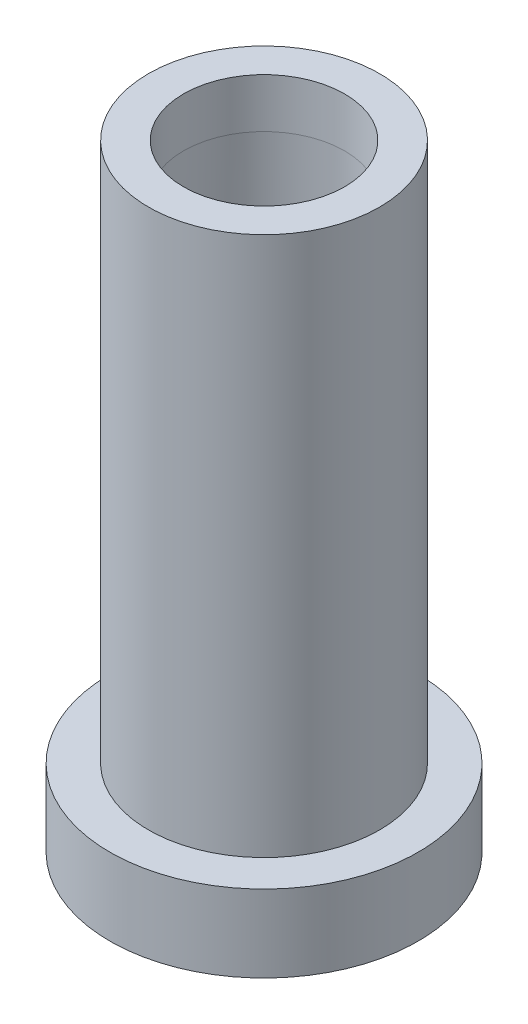
from build123d import *

# Parameters (mm, degrees)
CUT_EXTRUDE1_REACH = 44.426
SKETCH2_R          = 5.225


with BuildPart() as part:
    # Sketch1 → Revolve1 (revolve)
    with BuildSketch(Plane.XY):
        Polygon((0, 0), (10, 0), (10, 5), (7.5, 5), (7.5, 40), (0, 40), align=None)
    revolve(axis=Axis((0, 45, 0), (0, -1, 0)))

    # Sketch2 → Cut-Extrude1 (cut, up to next)
    with BuildSketch(Plane(origin=(0, 40, 0), x_dir=(1, 0, 0), z_dir=(0, 1, 0)), mode=Mode.PRIVATE) as cut_extrude1_sk1:
        Circle(SKETCH2_R)
    cut_extrude1_tool1 = extrude(cut_extrude1_sk1.sketch, amount=-CUT_EXTRUDE1_REACH, mode=Mode.PRIVATE) & part.part
    add(cut_extrude1_tool1.solids().sort_by_distance((0, 40, 0))[0], mode=Mode.SUBTRACT)

    # Cut-Sweep1: sweep along a curve in space
    with BuildLine() as cut_sweep1_path:
        ThreePointArc((0, 40, 5.225), (3.694632932, 40, 3.694632932), (5.225, 40, 0))
        ThreePointArc((5.225, 40, 0), (3.694632932, 40, -3.694632932), (0, 40, -5.225))
        ThreePointArc((0, 40, -5.225), (-3.694632932, 40, -3.694632932), (-5.225, 40, 0))
        ThreePointArc((-5.225, 40, 0), (-3.694632932, 40, 3.694632932), (0, 40, 5.225))
    # Sketch3 → Cut-Sweep1 (sweep, cut)
    with BuildSketch(Plane.XY):
        Polygon((5.225, 36.8), (6.188641914, 0), (5.225, 0), align=None)
    sweep(path=cut_sweep1_path.line, mode=Mode.SUBTRACT)


solid = part.part
